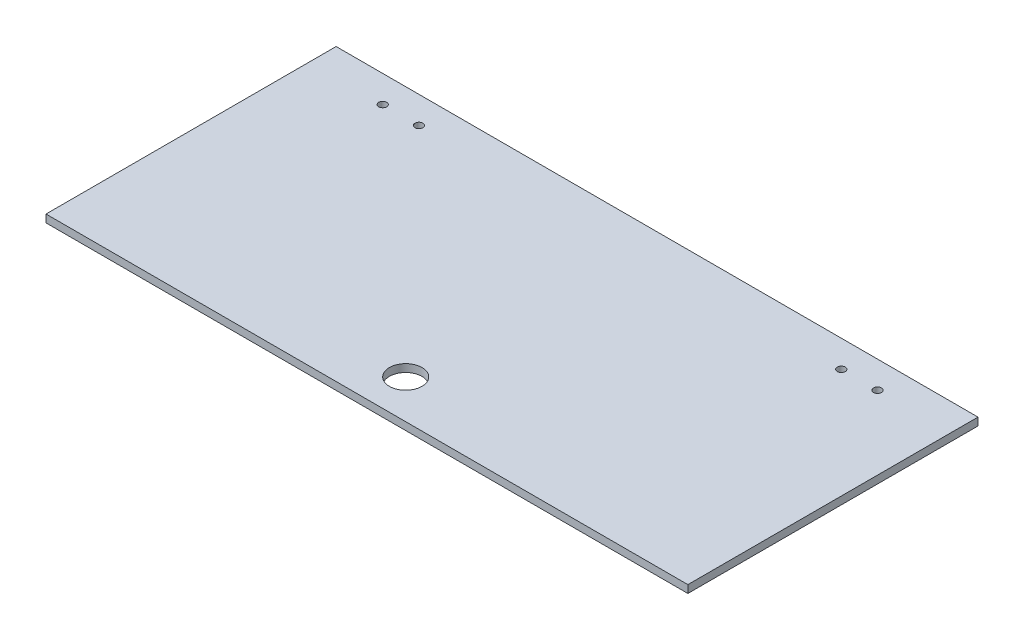
from build123d import *

# Parameters (mm, degrees)
SKETCH1_W           = 250
SKETCH1_H           = 113
SKETCH1_R           = 1.55
SKETCH1_R_2         = 6.35
BOSS_EXTRUDE1_DEPTH = 3


with BuildPart() as part:
    # Sketch1 → Boss-Extrude1 (new body)
    with BuildSketch(Plane(origin=(0, 0, 0), x_dir=(1, 0, 0), z_dir=(0, 1, 0))):
        with Locations((125, 56.5)):
            Rectangle(SKETCH1_W, SKETCH1_H)
        with Locations((28.65, 102.5)):
            Circle(SKETCH1_R, mode=Mode.SUBTRACT)
        with Locations((42.75, 102.5)):
            Circle(SKETCH1_R, mode=Mode.SUBTRACT)
        with Locations((207.25, 102.5)):
            Circle(SKETCH1_R, mode=Mode.SUBTRACT)
        with Locations((221.35, 102.5)):
            Circle(SKETCH1_R, mode=Mode.SUBTRACT)
        with Locations((125, 15.1)):
            Circle(SKETCH1_R_2, mode=Mode.SUBTRACT)
    extrude(amount=BOSS_EXTRUDE1_DEPTH)


solid = part.part
